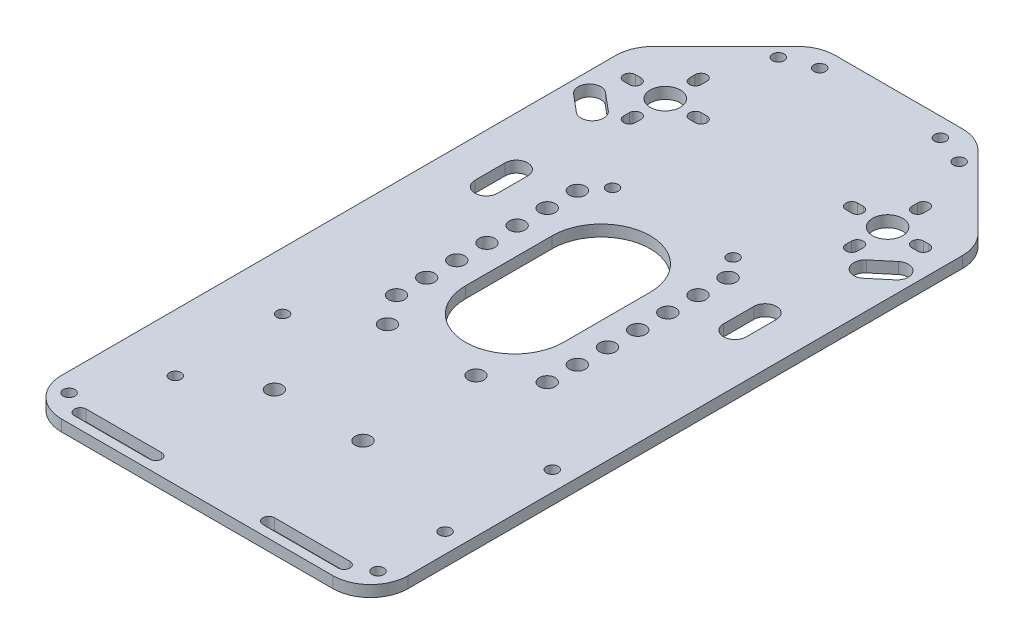
from build123d import *

# Parameters (mm, degrees)
SKETCH1_W           = 92
SKETCH1_H           = 186.23
SKETCH1_R           = 4
SKETCH1_R_2         = 1.55
BOSS_EXTRUDE1_DEPTH = 3
CHAMFER1_SIZE       = 25
FILLET1_R           = 10
SKETCH_1_R          = 2.1
CUT_EXTRUDE_1_DEPTH = 10
SKETCH_2_R          = 2.1
CUT_EXTRUDE_2_DEPTH = 10


with BuildPart() as part:
    # Sketch1 → Boss-Extrude1 (new body)
    with BuildSketch(Plane(origin=(0, 0, 0), x_dir=(1, 0, 0), z_dir=(0, 1, 0))):
        with Locations((0, -60.615)):
            Rectangle(SKETCH1_W, SKETCH1_H)
        with Locations((29.5, 0)):
            Circle(SKETCH1_R, mode=Mode.SUBTRACT)
        with Locations((-29.5, 0)):
            Circle(SKETCH1_R, mode=Mode.SUBTRACT)
        with Locations((16, 27.5)):
            Circle(SKETCH1_R_2, mode=Mode.SUBTRACT)
        with Locations((16, -27.5)):
            Circle(SKETCH1_R_2, mode=Mode.SUBTRACT)
        with Locations((-16, -27.5)):
            Circle(SKETCH1_R_2, mode=Mode.SUBTRACT)
        with Locations((-16, 27.5)):
            Circle(SKETCH1_R_2, mode=Mode.SUBTRACT)
        with Locations((40.79, -100.27)):
            Circle(SKETCH1_R_2, mode=Mode.SUBTRACT)
        with Locations((40.79, -128.73)):
            Circle(SKETCH1_R_2, mode=Mode.SUBTRACT)
        with Locations((-30.79, -128.73)):
            Circle(SKETCH1_R_2, mode=Mode.SUBTRACT)
        with Locations((-30.79, -100.27)):
            Circle(SKETCH1_R_2, mode=Mode.SUBTRACT)
        with Locations((24, 24.5)):
            Circle(SKETCH1_R_2, mode=Mode.SUBTRACT)
        with Locations((-24, 24.5)):
            Circle(SKETCH1_R_2, mode=Mode.SUBTRACT)
        with Locations((41, -146.73)):
            Circle(SKETCH1_R_2, mode=Mode.SUBTRACT)
        with Locations((-41, -146.73)):
            Circle(SKETCH1_R_2, mode=Mode.SUBTRACT)
        with BuildLine():
            Line((37.5, 1.55), (39, 1.55))
            ThreePointArc((39, 1.55), (40.55, 0), (39, -1.55))
            Line((39, -1.55), (37.5, -1.55))
            ThreePointArc((37.5, -1.55), (35.95, 0), (37.5, 1.55))
        make_face(mode=Mode.SUBTRACT)
        with BuildLine():
            Line((31.05, -8), (31.05, -9.5))
            ThreePointArc((31.05, -9.5), (29.5, -11.05), (27.95, -9.5))
            Line((27.95, -9.5), (27.95, -8))
            ThreePointArc((27.95, -8), (29.5, -6.45), (31.05, -8))
        make_face(mode=Mode.SUBTRACT)
        with BuildLine():
            Line((21.5, -1.55), (20, -1.55))
            ThreePointArc((20, -1.55), (18.45, 0), (20, 1.55))
            Line((20, 1.55), (21.5, 1.55))
            ThreePointArc((21.5, 1.55), (23.05, 0), (21.5, -1.55))
        make_face(mode=Mode.SUBTRACT)
        with BuildLine():
            Line((27.95, 8), (27.95, 9.5))
            ThreePointArc((27.95, 9.5), (29.5, 11.05), (31.05, 9.5))
            Line((31.05, 9.5), (31.05, 8))
            ThreePointArc((31.05, 8), (29.5, 6.45), (27.95, 8))
        make_face(mode=Mode.SUBTRACT)
        with BuildLine():
            Line((-27.95, 8), (-27.95, 9.5))
            ThreePointArc((-27.95, 9.5), (-29.5, 11.05), (-31.05, 9.5))
            Line((-31.05, 9.5), (-31.05, 8))
            ThreePointArc((-31.05, 8), (-29.5, 6.45), (-27.95, 8))
        make_face(mode=Mode.SUBTRACT)
        with BuildLine():
            Line((-21.5, -1.55), (-20, -1.55))
            ThreePointArc((-20, -1.55), (-18.45, 0), (-20, 1.55))
            Line((-20, 1.55), (-21.5, 1.55))
            ThreePointArc((-21.5, 1.55), (-23.05, 0), (-21.5, -1.55))
        make_face(mode=Mode.SUBTRACT)
        with BuildLine():
            Line((-31.05, -8), (-31.05, -9.5))
            ThreePointArc((-31.05, -9.5), (-29.5, -11.05), (-27.95, -9.5))
            Line((-27.95, -9.5), (-27.95, -8))
            ThreePointArc((-27.95, -8), (-29.5, -6.45), (-31.05, -8))
        make_face(mode=Mode.SUBTRACT)
        with BuildLine():
            Line((-37.5, 1.55), (-39, 1.55))
            ThreePointArc((-39, 1.55), (-40.55, 0), (-39, -1.55))
            Line((-39, -1.55), (-37.5, -1.55))
            ThreePointArc((-37.5, -1.55), (-35.95, 0), (-37.5, 1.55))
        make_face(mode=Mode.SUBTRACT)
        with BuildLine():
            Line((13, -46.5), (13, -69.5))
            ThreePointArc((13, -69.5), (0, -82.5), (-13, -69.5))
            Line((-13, -69.5), (-13, -46.5))
            ThreePointArc((-13, -46.5), (0, -33.5), (13, -46.5))
        make_face(mode=Mode.SUBTRACT)
        with BuildLine():
            Line((42.725522694, -11.094392704), (38.129256035, -14.951118362))
            ThreePointArc((38.129256035, -14.951118362), (33.902759877, -14.581347862), (34.272530377, -10.354851703))
            Line((34.272530377, -10.354851703), (38.868797036, -6.498126045))
            ThreePointArc((38.868797036, -6.498126045), (43.095293194, -6.867896546), (42.725522694, -11.094392704))
        make_face(mode=Mode.SUBTRACT)
        with BuildLine():
            Line((-42.725522694, -11.094392704), (-38.129256035, -14.951118362))
            ThreePointArc((-38.129256035, -14.951118362), (-33.902759877, -14.581347862), (-34.272530377, -10.354851703))
            Line((-34.272530377, -10.354851703), (-38.868797036, -6.498126045))
            ThreePointArc((-38.868797036, -6.498126045), (-43.095293194, -6.867896546), (-42.725522694, -11.094392704))
        make_face(mode=Mode.SUBTRACT)
        with BuildLine():
            Line((36, -36), (36, -44))
            ThreePointArc((36, -44), (33, -47), (30, -44))
            Line((30, -44), (30, -36))
            ThreePointArc((30, -36), (33, -33), (36, -36))
        make_face(mode=Mode.SUBTRACT)
        with BuildLine():
            Line((-36, -36), (-36, -44))
            ThreePointArc((-36, -44), (-33, -47), (-30, -44))
            Line((-30, -44), (-30, -36))
            ThreePointArc((-30, -36), (-33, -33), (-36, -36))
        make_face(mode=Mode.SUBTRACT)
        with BuildLine():
            Line((15, -148.18), (35, -148.18))
            ThreePointArc((35, -148.18), (36.55, -149.73), (35, -151.28))
            Line((35, -151.28), (15, -151.28))
            ThreePointArc((15, -151.28), (13.45, -149.73), (15, -148.18))
        make_face(mode=Mode.SUBTRACT)
        with BuildLine():
            Line((-15, -148.18), (-35, -148.18))
            ThreePointArc((-35, -148.18), (-36.55, -149.73), (-35, -151.28))
            Line((-35, -151.28), (-15, -151.28))
            ThreePointArc((-15, -151.28), (-13.45, -149.73), (-15, -148.18))
        make_face(mode=Mode.SUBTRACT)
    extrude(amount=BOSS_EXTRUDE1_DEPTH)

    # Chamfer1
    chamfer1_edges = [part.edges().sort_by_distance(p)[0] for p in [
        (46, 1.5, -32.5),
        (-46, 1.5, -32.5),
    ]]
    chamfer(chamfer1_edges, length=CHAMFER1_SIZE)

    # Fillet1
    fillet1_edges = [part.edges().sort_by_distance(p)[0] for p in [
        (-46, 1.5, 153.73),
        (46, 1.5, 153.73),
        (46, 1.5, -7.5),
        (21, 1.5, -32.5),
        (-46, 1.5, -7.5),
        (-21, 1.5, -32.5),
    ]]
    fillet(fillet1_edges, radius=FILLET1_R)

    # 草图1 → 切除-拉伸1 (cut)
    with BuildSketch(Plane(origin=(0, 3, 0), x_dir=(1, 0, 0), z_dir=(0, 1, 0))):
        with Locations((9, -88.73)):
            Circle(SKETCH_1_R)
        with Locations((9, -118.73)):
            Circle(SKETCH_1_R)
        with Locations((-14.5, -118.73)):
            Circle(SKETCH_1_R)
        with Locations((-14.5, -88.73)):
            Circle(SKETCH_1_R)
    extrude(amount=-CUT_EXTRUDE_1_DEPTH, mode=Mode.SUBTRACT)

    # 草图2 → 切除-拉伸2 (cut)
    with BuildSketch(Plane(origin=(0, 3, 0), x_dir=(1, 0, 0), z_dir=(0, 1, 0))):
        with Locations((-20, -56.821452148)):
            Circle(SKETCH_2_R)
        with Locations((-20, -48.821452148)):
            Circle(SKETCH_2_R)
        with Locations((-20, -40.821452148)):
            Circle(SKETCH_2_R)
        with Locations((-20, -32.821452148)):
            Circle(SKETCH_2_R)
        with Locations((-20, -64.821452148)):
            Circle(SKETCH_2_R)
        with Locations((-20, -72.821452148)):
            Circle(SKETCH_2_R)
        with Locations((-20, -80.821452148)):
            Circle(SKETCH_2_R)
        with Locations((20, -80.821452148)):
            Circle(SKETCH_2_R)
        with Locations((20, -72.821452148)):
            Circle(SKETCH_2_R)
        with Locations((20, -64.821452148)):
            Circle(SKETCH_2_R)
        with Locations((20, -32.821452148)):
            Circle(SKETCH_2_R)
        with Locations((20, -40.821452148)):
            Circle(SKETCH_2_R)
        with Locations((20, -48.821452148)):
            Circle(SKETCH_2_R)
        with Locations((20, -56.821452148)):
            Circle(SKETCH_2_R)
    extrude(amount=-CUT_EXTRUDE_2_DEPTH, mode=Mode.SUBTRACT)


solid = part.part
